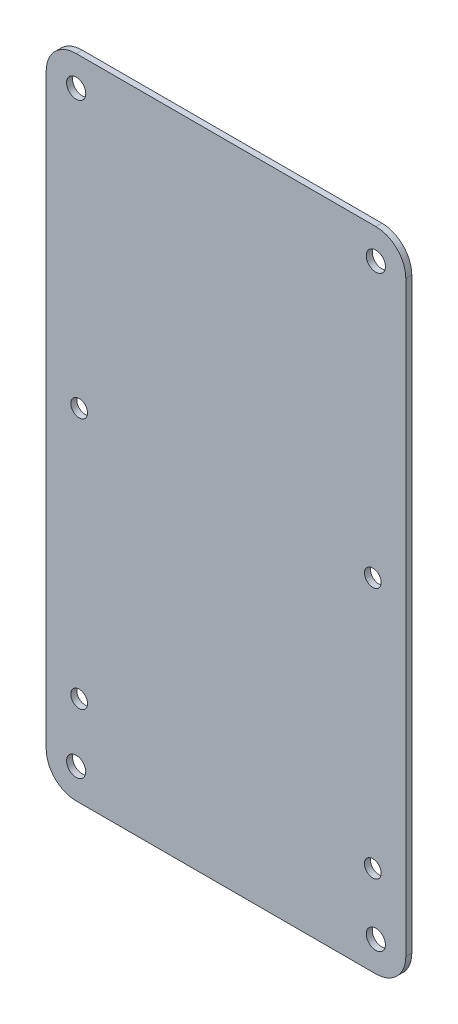
from build123d import *

# Parameters (mm, degrees)
SKETCH_1_W          = 60
SKETCH_1_H          = 108
EXTRUDE_1_DEPTH     = 1
SKETCH_4_R          = 1.4
CUT_EXTRUDE_2_DEPTH = 10
SKETCH_9_R          = 1.6
CUT_EXTRUDE_5_DEPTH = 62.781874365
FILLET_1_R          = 5


with BuildPart() as part:
    # ｽｹｯﾁ1 → ﾎﾞｽ - 押し出し1 (new body)
    with BuildSketch(Plane.XY):
        Rectangle(SKETCH_1_W, SKETCH_1_H)
    extrude(amount=EXTRUDE_1_DEPTH)

    # ｽｹｯﾁ4 → ｶｯﾄ - 押し出し2 (cut)
    with BuildSketch(Plane.XY.offset(1)):
        with Locations((-24.5, 3)):
            Circle(SKETCH_4_R)
        with Locations((-24.5, -39)):
            Circle(SKETCH_4_R)
        with Locations((24.5, 3)):
            Circle(SKETCH_4_R)
        with Locations((24.5, -39)):
            Circle(SKETCH_4_R)
    extrude(amount=-CUT_EXTRUDE_2_DEPTH, mode=Mode.SUBTRACT)

    # ｽｹｯﾁ9 → ｶｯﾄ - 押し出し5 (cut, through all)
    with BuildSketch(Plane.XY.offset(1)):
        with Locations((25, 49)):
            Circle(SKETCH_9_R)
        with Locations((-25, 49)):
            Circle(SKETCH_9_R)
        with Locations((-25, -49)):
            Circle(SKETCH_9_R)
        with Locations((25, -49)):
            Circle(SKETCH_9_R)
    extrude(amount=-CUT_EXTRUDE_5_DEPTH, mode=Mode.SUBTRACT)

    # ﾌｨﾚｯﾄ1
    fillet_1_edges = [part.edges().sort_by_distance(p)[0] for p in [
        (-30, -54, 0.5),
        (30, -54, 0.5),
        (-30, 54, 0.5),
        (30, 54, 0.5),
    ]]
    fillet(fillet_1_edges, radius=FILLET_1_R)


solid = part.part
